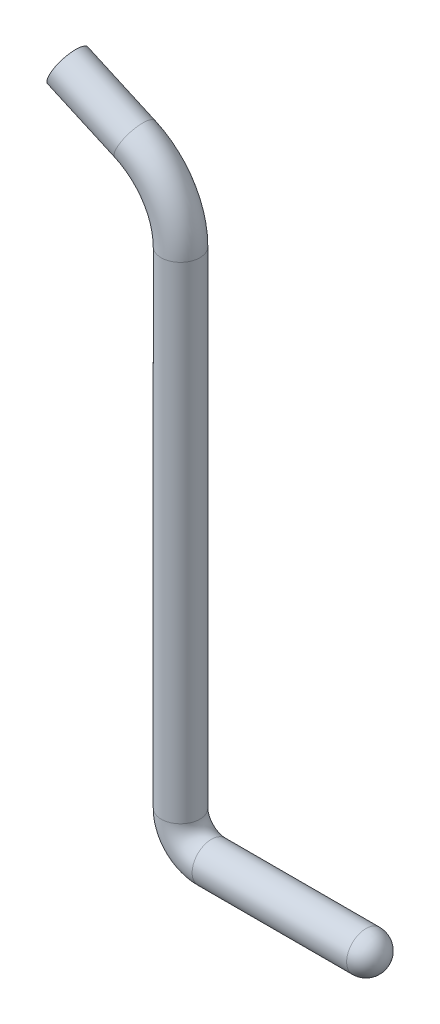
from build123d import *
from build123d.topology import SkipClean

# Parameters (mm, degrees)
SWEEP1_PROFILE_R = 12.5


with BuildPart() as part:
    # Sweep1: sweep along a path in Sketch1
    with BuildLine(Plane.XY) as sweep1_path:
        Line((120, -20), (20, -20))
        ThreePointArc((20, -20), (5.857864376, -14.142135624), (0, 0))
        Line((0, 0), (0, 314.65))
        ThreePointArc((0, 314.65), (-8.037977367, 341.838024139), (-29.567546263, 360.28457937))
        Line((-29.567546263, 360.28457937), (-73.011665824, 379.736275328))
    # Sweep1 profile (on start of the path) → Sweep1 (sweep)
    with BuildSketch(Plane(origin=(120, -20, 0), x_dir=(0, 0, -1), z_dir=(-1, 0, 0))):
        Circle(SWEEP1_PROFILE_R)
    sweep(path=sweep1_path.line)

    # Sketch16 → Revolve1 (revolve)
    with SkipClean():  # the faces are left unmerged after this step: merging them gives an invalid solid
        with BuildSketch(Plane.XY):
            with BuildLine():
                Line((120, -7.5), (120, -32.5))
                ThreePointArc((120, -32.5), (132.5, -20), (120, -7.5))
            make_face()
        revolve(axis=Axis((120, -7.5, 0), (0, -1, 0)))


solid = part.part
